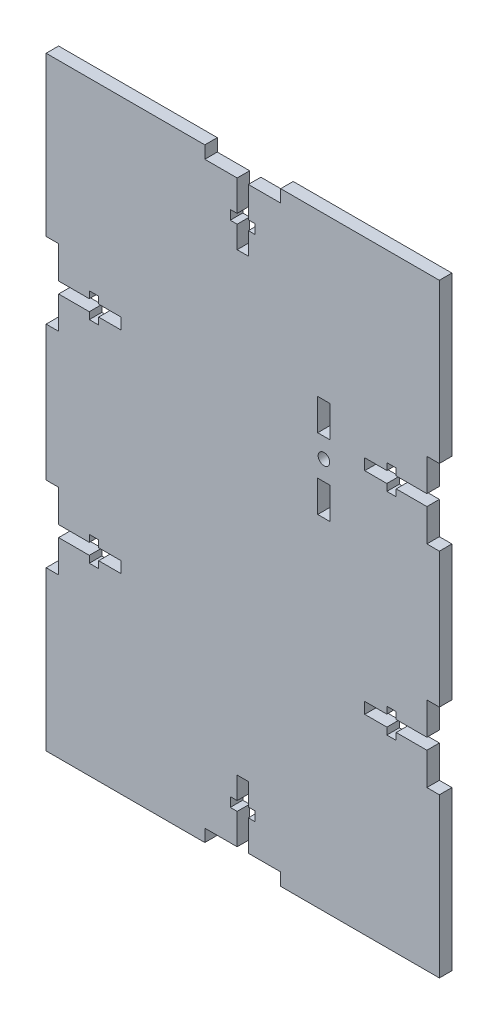
from build123d import *

# Parameters (mm, degrees)
BOSS_EXTRUDE1_DEPTH = 3.18
CUT_EXTRUDE9_DEPTH  = 92.718008183
CUT_EXTRUDE10_DEPTH = 92.718008183
SKETCH32_4_W        = 3.18
SKETCH32_4_H        = 8
SKETCH32_4_R        = 1.47
CUT_EXTRUDE18_DEPTH = 92.718008183


with BuildPart() as part:
    # Sketch1 → Boss-Extrude1 (new body)
    with BuildSketch(Plane.XY):
        Polygon((-50, 76.825), (-16.666666667, 76.825), (16.666666667, 76.825), (50, 76.825), (50, -76.825), (-50, -76.825), align=None)
    extrude(amount=BOSS_EXTRUDE1_DEPTH)

    # Sketch20 → Cut-Extrude9 (cut, through all)
    with BuildSketch(Plane.XY.offset(3.18)):
        Polygon((-9.65, 76.825), (9.65, 76.825), (9.65, 73.645), (1.425, 73.645), (1.425, 65.845), (3.175, 65.845), (3.175, 63.465), (1.425, 63.465), (1.425, 57.845), (-1.425, 57.845), (-1.425, 63.465), (-3.175, 63.465), (-3.175, 65.845), (-1.425, 65.845), (-1.425, 73.645), (-9.65, 73.645), align=None)
    cut_extrude9 = extrude(amount=-CUT_EXTRUDE9_DEPTH, mode=Mode.SUBTRACT)

    # Mirror3: Cut-Extrude9 across plane
    add(cut_extrude9.mirror(Plane.ZX), mode=Mode.SUBTRACT)

    # Sketch23 → Cut-Extrude10 (cut, through all)
    with BuildSketch(Plane.XY.offset(3.18)):
        Polygon((-50, 17.175), (-50, 36.475), (-46.82, 36.475), (-46.82, 28.25), (-39.02, 28.25), (-39.02, 30), (-36.64, 30), (-36.64, 28.25), (-31.02, 28.25), (-31.02, 25.4), (-36.64, 25.4), (-36.64, 23.65), (-39.02, 23.65), (-39.02, 25.4), (-46.82, 25.4), (-46.82, 17.175), align=None)
        Polygon((-50, -36.475), (-50, -17.175), (-46.82, -17.175), (-46.82, -25.4), (-39.02, -25.4), (-39.02, -23.65), (-36.64, -23.65), (-36.64, -25.4), (-31.02, -25.4), (-31.02, -28.25), (-36.64, -28.25), (-36.64, -30), (-39.02, -30), (-39.02, -28.25), (-46.82, -28.25), (-46.82, -36.475), align=None)
    cut_extrude10 = extrude(amount=-CUT_EXTRUDE10_DEPTH, mode=Mode.SUBTRACT)

    # Mirror4: Cut-Extrude10 across plane
    add(cut_extrude10.mirror(Plane(origin=(0, 0, 0), x_dir=(0, 0, 1), z_dir=(1, 0, 0))), mode=Mode.SUBTRACT)

    # Sketch32<4> → Cut-Extrude18 (cut, through all)
    with BuildSketch(Plane.XY.offset(3.18)):
        with Locations((20.65, 13.782937163)):
            Rectangle(SKETCH32_4_W, SKETCH32_4_H)
        with Locations((20.65, 31.782937163)):
            Rectangle(SKETCH32_4_W, SKETCH32_4_H)
        with Locations((20.65, 22.782937163)):
            Circle(SKETCH32_4_R)
    extrude(amount=-CUT_EXTRUDE18_DEPTH, mode=Mode.SUBTRACT)


solid = part.part
